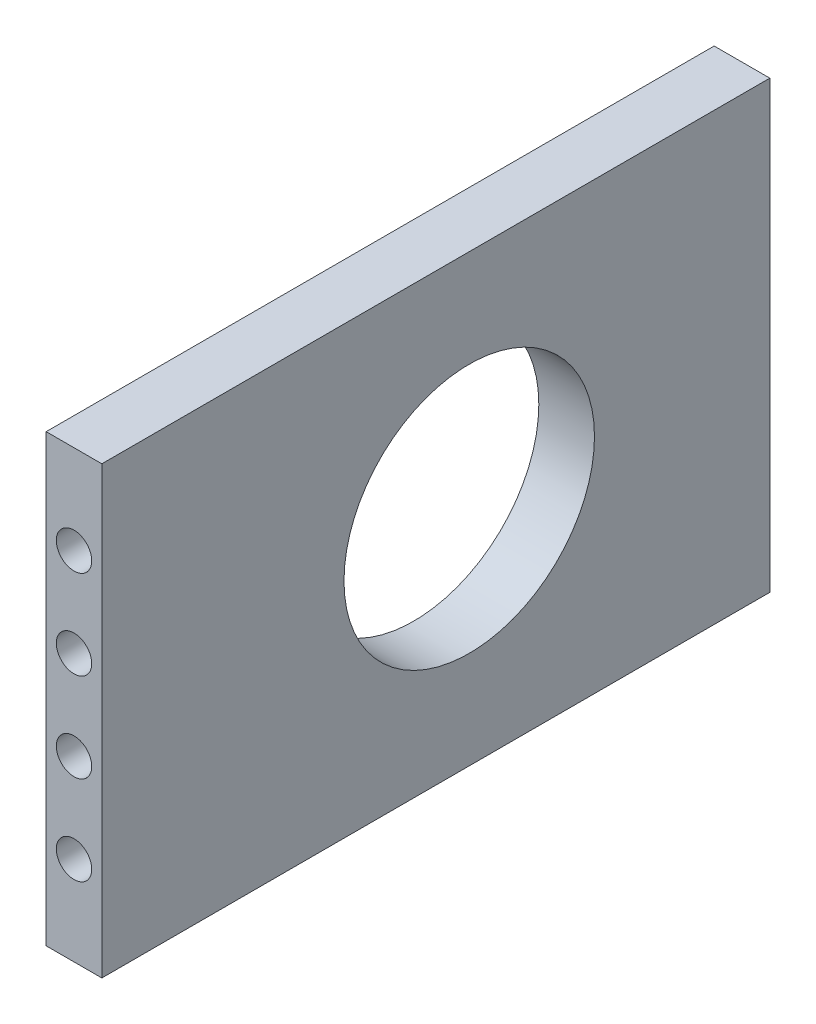
from build123d import *

# Parameters (mm, degrees)
SKETCH2_W                  = 76.2
SKETCH2_H                  = 50.8
BOSS_EXTRUDE2_DEPTH        = 6.35
F_10_32_TAPPED_HOLE1_D     = 4.0386
F_10_32_TAPPED_HOLE1_DEPTH = 25.4
F_10_32_TAPPED_HOLE1_TIP   = 1.213317848
SKETCH6_R                  = 14.2875
CUT_EXTRUDE1_DEPTH         = 47.228697797


with BuildPart() as part:
    # Sketch2 → Boss-Extrude2 (new body)
    with BuildSketch(Plane(origin=(0, 0, 0), x_dir=(0, 0, -1), z_dir=(1, 0, 0))):
        Rectangle(SKETCH2_W, SKETCH2_H)
    extrude(amount=BOSS_EXTRUDE2_DEPTH)

    # #10-32 Tapped Hole1
    with Locations(Plane.XY.offset(38.1)):
        with Locations((3.175, -15.24), (3.175, -5.08), (3.175, 5.08), (3.175, 15.24)):
            Hole(F_10_32_TAPPED_HOLE1_D / 2, depth=F_10_32_TAPPED_HOLE1_DEPTH)
            with Locations((0, 0, -(F_10_32_TAPPED_HOLE1_DEPTH + F_10_32_TAPPED_HOLE1_TIP / 2))):  # 118° drill point
                Cone(0, F_10_32_TAPPED_HOLE1_D / 2, F_10_32_TAPPED_HOLE1_TIP, mode=Mode.SUBTRACT)

    # Sketch6 → Cut-Extrude1 (cut, through all)
    with BuildSketch(Plane(origin=(6.35, 0, 0), x_dir=(0, 0, -1), z_dir=(1, 0, 0))):
        with Locations((3.81, 0)):
            Circle(SKETCH6_R)
    extrude(amount=-CUT_EXTRUDE1_DEPTH, mode=Mode.SUBTRACT)


solid = part.part
